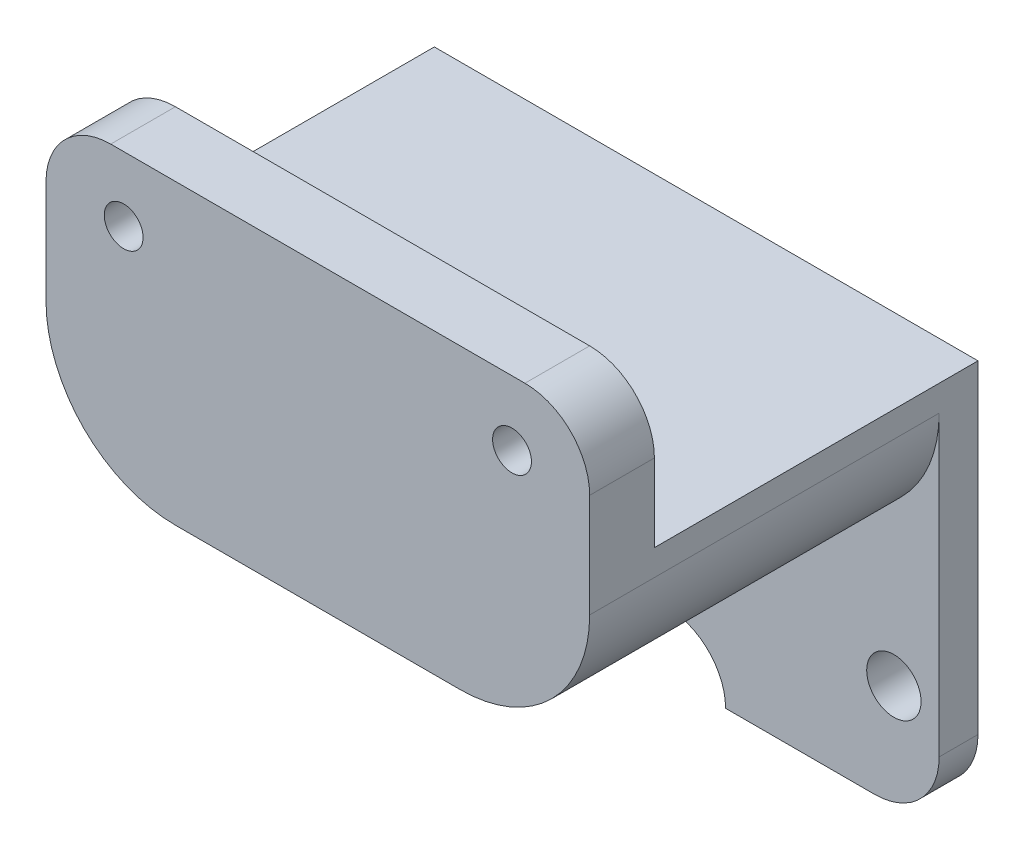
from build123d import *

# Parameters (mm, degrees)
SKETCH3_R           = 1.5
BOSS_EXTRUDE3_DEPTH = 5
BOSS_EXTRUDE4_START = -25
BOSS_EXTRUDE4_DEPTH = 25
FILLET4_R           = 5
SKETCH9_W           = 42
SKETCH9_H           = 3
BOSS_EXTRUDE7_DEPTH = 30
FILLET6_R           = 5
FILLET7_R           = 5
SKETCH11_R          = 2.1
CUT_EXTRUDE2_DEPTH  = 30


with BuildPart() as part:
    # Sketch3 → Boss-Extrude3 (new body)
    with BuildSketch(Plane.XY):
        with BuildLine():
            Line((-22.592834793, 16.50935751), (-6.092834793, 16.50935751))
            Line((-6.092834793, 16.50935751), (-6.092834793, 3.50935751))
            ThreePointArc((-6.092834793, 3.50935751), (-9.021766981, -3.561710302), (-16.092834793, -6.49064249))
            Line((-16.092834793, -6.49064249), (-38.092834793, -6.49064249))
            ThreePointArc((-38.092834793, -6.49064249), (-45.163902605, -3.561710302), (-48.092834793, 3.50935751))
            Line((-48.092834793, 3.50935751), (-48.092834793, 16.50935751))
            Line((-48.092834793, 16.50935751), (-31.592834793, 16.50935751))
            Line((-31.592834793, 16.50935751), (-22.592834793, 16.50935751))
        make_face()
        with Locations((-42.092834793, 11.50935751)):
            Circle(SKETCH3_R, mode=Mode.SUBTRACT)
        with Locations((-12.092834793, 11.50935751)):
            Circle(SKETCH3_R, mode=Mode.SUBTRACT)
    extrude(amount=BOSS_EXTRUDE3_DEPTH)

    # Sketch6 → Boss-Extrude4 (add)
    with BuildSketch(Plane.XY.offset(BOSS_EXTRUDE4_START)):
        with BuildLine():
            Line((-48.092834793, 5.50935751), (-48.092834793, 3.50935751))
            ThreePointArc((-48.092834793, 3.50935751), (-45.163902605, -3.561710302), (-38.092834793, -6.49064249))
            Line((-38.092834793, -6.49064249), (-16.092834793, -6.49064249))
            ThreePointArc((-16.092834793, -6.49064249), (-9.021766981, -3.561710302), (-6.092834793, 3.50935751))
            Line((-6.092834793, 3.50935751), (-6.092834793, 5.50935751))
            Line((-6.092834793, 5.50935751), (-48.092834793, 5.50935751))
        make_face()
    extrude(amount=BOSS_EXTRUDE4_DEPTH)

    # Fillet4
    fillet4_edges = [part.edges().sort_by_distance(p)[0] for p in [
        (-48.092834793, 16.50935751, 2.5),
        (-6.092834793, 16.50935751, 2.5),
    ]]
    fillet(fillet4_edges, radius=FILLET4_R)

    # Sketch9 → Boss-Extrude7 (add)
    with BuildSketch(Plane(origin=(0, 5.50935751, 0), x_dir=(1, 0, 0), z_dir=(0, 1, 0))):
        with Locations((-27.092834793, 23.5)):
            Rectangle(SKETCH9_W, SKETCH9_H)
    extrude(amount=-BOSS_EXTRUDE7_DEPTH)

    # Fillet6
    fillet6_edges = [part.edges().sort_by_distance(p)[0] for p in [
        (-6.092834793, -24.49064249, -23.5),
    ]]
    fillet(fillet6_edges, radius=FILLET6_R)

    # Fillet7
    fillet7_edges = [part.edges().sort_by_distance(p)[0] for p in [
        (-48.092834793, -24.49064249, -23.5),
    ]]
    fillet(fillet7_edges, radius=FILLET7_R)

    # Sketch11 → Cut-Extrude2 (cut)
    with BuildSketch(Plane(origin=(0, 0, -25), x_dir=(-1, 0, 0), z_dir=(0, 0, -1))):
        with Locations((9.592834793, -16.49064249)):
            Circle(SKETCH11_R)
        with Locations((44.592834793, -16.49064249)):
            Circle(SKETCH11_R)
        with BuildLine():
            Line((22.592834793, -24.49064249), (31.592834793, -24.49064249))
            ThreePointArc((31.592834793, -24.49064249), (27.092834793, -19.99064249), (22.592834793, -24.49064249))
        make_face()
    extrude(amount=-CUT_EXTRUDE2_DEPTH, mode=Mode.SUBTRACT)


solid = part.part
